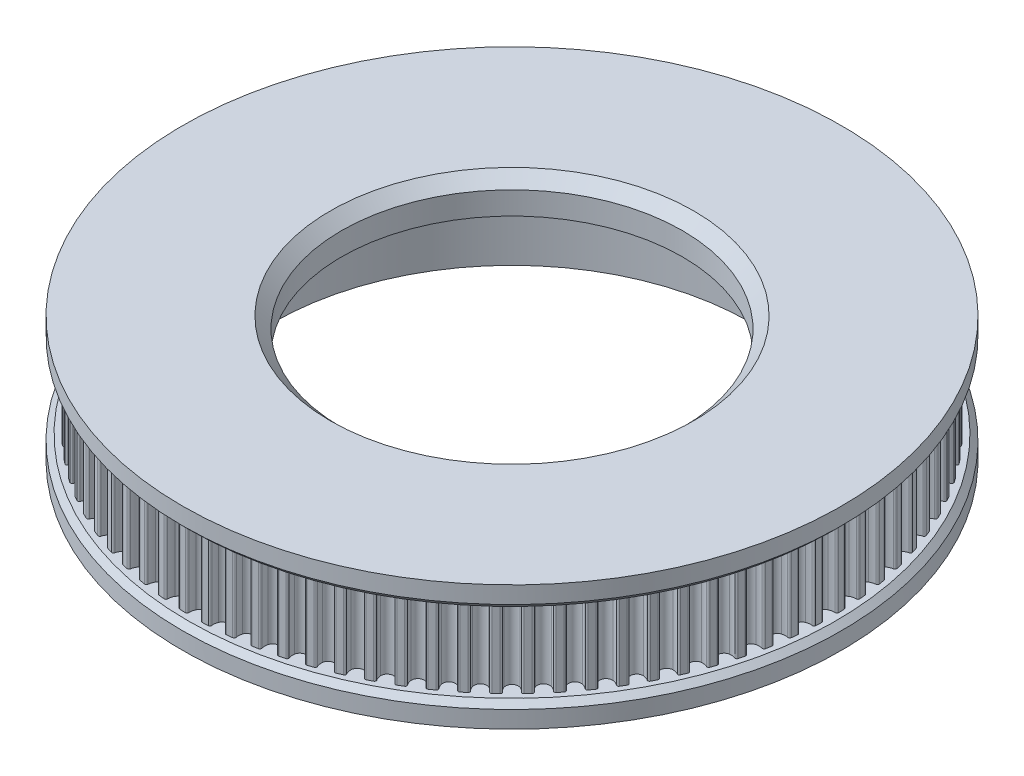
from build123d import *

# Parameters (mm, degrees)
SKETCH1_R           = 28.01
BOSS_EXTRUDE1_DEPTH = 11
CUT_EXTRUDE1_START  = -9
CUT_EXTRUDE1_DEPTH  = 7
CIRPATTERN1_COUNT   = 88
BOSS_EXTRUDE2_START = -2
SKETCH10_R          = 29
SKETCH10_R_2        = 28.01
BOSS_EXTRUDE2_DEPTH = 2
SKETCH11_R          = 29
BOSS_EXTRUDE3_DEPTH = 2
CHAMFER1_SIZE       = 0.5
SKETCH12_R          = 21
CUT_EXTRUDE2_DEPTH  = 8
SKETCH13_R          = 15
CUT_EXTRUDE3_DEPTH  = 42.785164832
CHAMFER2_SIZE       = 1


with BuildPart() as part:
    # Sketch1 → Boss-Extrude1 (new body)
    with BuildSketch(Plane(origin=(0, 0, 0), x_dir=(1, 0, 0), z_dir=(0, 1, 0))):
        with Locations(Location((0, 0, 0), (0, 0, 270))):
            Circle(SKETCH1_R)
    extrude(amount=BOSS_EXTRUDE1_DEPTH)

    # Sketch8 → Cut-Extrude1 (cut)
    with BuildSketch(Plane(origin=(0, 11, 0), x_dir=(1, 0, 0), z_dir=(0, 1, 0)).offset(CUT_EXTRUDE1_START)):
        with BuildLine():
            ThreePointArc((-0.5006251, 27.320418054), (-1.6e-08, 27.005), (0.500625086, 27.320418024))
            ThreePointArc((0.500625086, 27.320418024), (0.582345535, 27.572540617), (0.594963582, 27.837275992))
            ThreePointArc((0.594963582, 27.837275992), (0.635292773, 27.952968255), (0.748426451, 27.999999247))
            ThreePointArc((0.748426451, 27.999999247), (1.4e-08, 28.01), (-0.748426422, 27.999999248))
            ThreePointArc((-0.748426422, 27.999999248), (-0.635292763, 27.952968244), (-0.594963582, 27.837275992))
            ThreePointArc((-0.594963582, 27.837275992), (-0.582345538, 27.572540634), (-0.5006251, 27.320418054))
        make_face()
    cut_extrude1 = extrude(amount=CUT_EXTRUDE1_DEPTH, mode=Mode.SUBTRACT)

    # CirPattern1: Cut-Extrude1 ×88 about axis
    cirpattern1_axis = Axis((0, 0, 0), (0, 1, 0))
    for i in range(1, CIRPATTERN1_COUNT):
        add(cut_extrude1.rotate(cirpattern1_axis, i * 360 / CIRPATTERN1_COUNT), mode=Mode.SUBTRACT)

    # Sketch10 → Boss-Extrude2 (add)
    with BuildSketch(Plane(origin=(0, 11, 0), x_dir=(1, 0, 0), z_dir=(0, 1, 0)).offset(BOSS_EXTRUDE2_START)):
        with Locations(Location((0, 0, 0), (0, 0, 270))):
            Circle(SKETCH10_R)
        with Locations(Location((0, 0, 0), (0, 0, 91.531123884))):
            Circle(SKETCH10_R_2, mode=Mode.SUBTRACT)
    extrude(amount=BOSS_EXTRUDE2_DEPTH)

    # Sketch11 → Boss-Extrude3 (add)
    with BuildSketch(Plane.XZ):
        with Locations(Location((0, 0, 0), (0, 0, 90))):
            Circle(SKETCH11_R)
    extrude(amount=-BOSS_EXTRUDE3_DEPTH)

    # Chamfer1
    chamfer1_edges = [part.edges().sort_by_distance(p)[0] for p in [
        (0, 9, -29),
        (0, 2, -29),
    ]]
    chamfer(chamfer1_edges, length=CHAMFER1_SIZE)

    # Sketch12 → Cut-Extrude2 (cut)
    with BuildSketch(Plane.XZ):
        with Locations(Location((0, 0, 0), (0, 0, 270))):
            Circle(SKETCH12_R)
    extrude(amount=-CUT_EXTRUDE2_DEPTH, mode=Mode.SUBTRACT)

    # Sketch13 → Cut-Extrude3 (cut, through all)
    with BuildSketch(Plane.XZ.offset(-8)):
        with Locations(Location((0, 0, 0), (0, 0, 270))):
            Circle(SKETCH13_R)
    extrude(amount=-CUT_EXTRUDE3_DEPTH, mode=Mode.SUBTRACT)

    # Chamfer2
    chamfer2_edges = [part.edges().sort_by_distance(p)[0] for p in [
        (0, 11, 15),
    ]]
    chamfer(chamfer2_edges, length=CHAMFER2_SIZE)


solid = part.part
